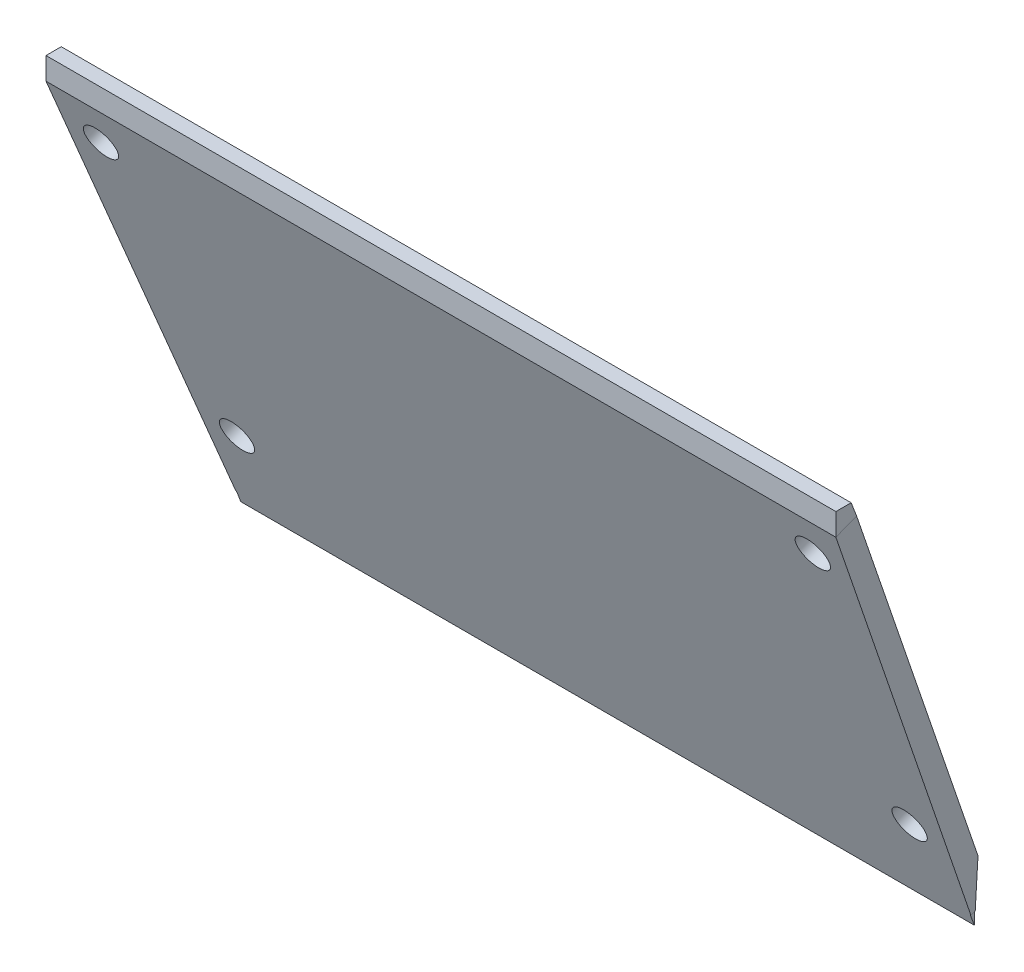
from build123d import *

# Parameters (mm, degrees)
BOSS_EXTRUDE1_DEPTH     = 1
BOSS_EXTRUDE2_REACH     = 55.976
SKETCH4_W               = 35.529511627
SKETCH4_H               = 1
CUT_EXTRUDE3_DEPTH      = 54.861211874
CUT_EXTRUDE3_DEPTH_BACK = 54.861211874
CUT_EXTRUDE4_DEPTH      = 52.541211292
CUT_EXTRUDE4_DEPTH_BACK = 52.541211292
CAVITY1_START           = -31.431872012
CAVITY1_OUTLINE_R       = 0.75
CAVITY1_DEPTH           = 1


# Read off the part's stored shape, not the designer's step: Cavity1
with BuildPart() as part:
    # Sketch1 → Boss-Extrude1 (new body)
    with BuildSketch(Plane(origin=(0, -11.283384476, 29.336799637), x_dir=(-1, 0, 0), z_dir=(0, 0.35897907930886913, -0.9333456062030595))):
        Polygon((2.285907974, 20.525558465), (-33.243603653, 20.525558465), (-32.011277476, 0.168683291), (-31.978847839, 0.168683291), (-31.978847839, -0.36702395), (1.021152161, -0.36702395), (1.021152161, 0.168683291), (1.053581797, 0.168683291), align=None)
    extrude(amount=BOSS_EXTRUDE1_DEPTH)

    # Boss-Extrude2: up to this plane
    boss_extrude2_end = Plane(origin=(160.237455752, 8.874055334, 36.705045718), z_dir=(0, -1, 0))
    # Sketch4 → Boss-Extrude2 (add, up to the surface)
    with BuildSketch(Plane(origin=(0, 19.157439808, 7.36824608), x_dir=(1, 0, 0), z_dir=(0, 0.9333456062030596, 0.35897907930886913)), mode=Mode.PRIVATE) as boss_extrude2_sk1:
        with Locations((15.47884784, -30.931872012)):
            Rectangle(SKETCH4_W, SKETCH4_H)
    boss_extrude2_tool1 = split(extrude(boss_extrude2_sk1.sketch, amount=BOSS_EXTRUDE2_REACH, mode=Mode.PRIVATE), bisect_by=boss_extrude2_end, keep=Keep.BOTH, mode=Mode.PRIVATE)
    add(boss_extrude2_tool1.solids().sort_by_distance((15.478848, 8.053545, 36.238373))[0])

    # Sketch5 → Cut-Extrude3 (cut, two sides: drawn at the far end of the back side and taken through both)
    with BuildSketch(Plane(origin=(0, 8.874055334, 0), x_dir=(1, 0, 0), z_dir=(0, 1, 0)).offset(-CUT_EXTRUDE3_DEPTH_BACK)):
        Polygon((116.276952597, -36.705045717), (33.243603653, -36.705045717), (-2.285907974, -36.705045717), (-85.319256919, -36.705045717), (-85.319256919, -202.771743607), (116.276952597, -202.771743607), align=None)
    extrude(amount=CUT_EXTRUDE3_DEPTH + CUT_EXTRUDE3_DEPTH_BACK, mode=Mode.SUBTRACT)

    # Sketch6 → Cut-Extrude4 (cut, two sides: drawn at the far end of the back side and taken through both)
    with BuildSketch(Plane(origin=(31.978847839, 0, 0), x_dir=(0, 0, -1), z_dir=(1, 0, 0)).offset(-CUT_EXTRUDE4_DEPTH_BACK)):
        Polygon((-29.205045717, -65.283704575), (-29.205045717, -11.625944667), (-29.205045717, -5.8346384), (-29.205045717, 47.823121508), (78.110474099, 47.823121508), (78.110474099, -65.283704575), align=None)
    extrude(amount=CUT_EXTRUDE4_DEPTH + CUT_EXTRUDE4_DEPTH_BACK, mode=Mode.SUBTRACT)

    # Cavity1 outline → Cavity1 (cut)
    with BuildSketch(Plane(origin=(0, 0, 0), x_dir=(1, 0, 0), z_dir=(0, 0.3589790793088689, -0.9333456062030596)).offset(CAVITY1_START)):
        with Locations((-0.531246108, -18.525558467)):
            Circle(CAVITY1_OUTLINE_R)
        with Locations((0.351610097, -3.941600191)):
            Circle(CAVITY1_OUTLINE_R)
        with Locations((30.606085582, -3.941600191)):
            Circle(CAVITY1_OUTLINE_R)
        with Locations((31.488941787, -18.525558467)):
            Circle(CAVITY1_OUTLINE_R)
    extrude(amount=CAVITY1_DEPTH, mode=Mode.SUBTRACT)


solid = part.part
